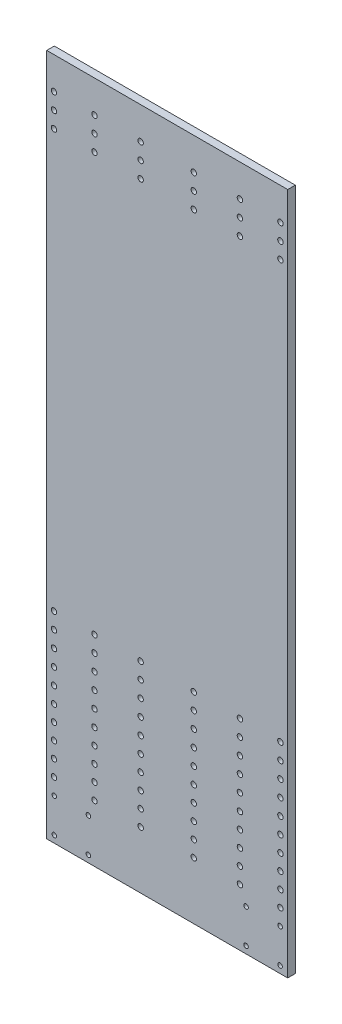
from build123d import *

# Parameters (mm, degrees)
ESQUISSE1_W              = 190.5
ESQUISSE1_H              = 539.75
BOSS_EXTRU_1_DEPTH       = 6
D_GAGEMENT_M41_OUTLINE_R = 2.15
D_GAGEMENT_M41_DEPTH     = 6
D_GAGEMENT_M31_D         = 3.6
D_GAGEMENT_M31_DEPTH     = 6
D_GAGEMENT_M31_TIP       = 1.081549114


# Read off the part's stored shape, not the designer's step: Dégagement M41
with BuildPart() as part:
    # Esquisse1 → Boss.-Extru.1 (new body)
    with BuildSketch(Plane.XY):
        Rectangle(ESQUISSE1_W, ESQUISSE1_H)
    extrude(amount=BOSS_EXTRU_1_DEPTH)

    # Dégagement M41 outline → Dégagement M41 (cut)
    with BuildSketch(Plane.XY):
        with Locations((89.49, -224.625)):
            Circle(D_GAGEMENT_M41_OUTLINE_R)
        with Locations((57.49, -224.625)):
            Circle(D_GAGEMENT_M41_OUTLINE_R)
        with Locations((21, -224.625)):
            Circle(D_GAGEMENT_M41_OUTLINE_R)
        with Locations((-21, -224.625)):
            Circle(D_GAGEMENT_M41_OUTLINE_R)
        with Locations((-57.49, -224.625)):
            Circle(D_GAGEMENT_M41_OUTLINE_R)
        with Locations((-89.49, -224.625)):
            Circle(D_GAGEMENT_M41_OUTLINE_R)
        with Locations((89.49, -212.125)):
            Circle(D_GAGEMENT_M41_OUTLINE_R)
        with Locations((57.49, -212.125)):
            Circle(D_GAGEMENT_M41_OUTLINE_R)
        with Locations((21, -212.125)):
            Circle(D_GAGEMENT_M41_OUTLINE_R)
        with Locations((-21, -212.125)):
            Circle(D_GAGEMENT_M41_OUTLINE_R)
        with Locations((-57.49, -212.125)):
            Circle(D_GAGEMENT_M41_OUTLINE_R)
        with Locations((-89.49, -212.125)):
            Circle(D_GAGEMENT_M41_OUTLINE_R)
        with Locations((89.49, -199.625)):
            Circle(D_GAGEMENT_M41_OUTLINE_R)
        with Locations((57.49, -199.625)):
            Circle(D_GAGEMENT_M41_OUTLINE_R)
        with Locations((21, -199.625)):
            Circle(D_GAGEMENT_M41_OUTLINE_R)
        with Locations((-21, -199.625)):
            Circle(D_GAGEMENT_M41_OUTLINE_R)
        with Locations((-57.49, -199.625)):
            Circle(D_GAGEMENT_M41_OUTLINE_R)
        with Locations((-89.49, -199.625)):
            Circle(D_GAGEMENT_M41_OUTLINE_R)
        with Locations((89.49, -187.125)):
            Circle(D_GAGEMENT_M41_OUTLINE_R)
        with Locations((57.49, -187.125)):
            Circle(D_GAGEMENT_M41_OUTLINE_R)
        with Locations((21, -187.125)):
            Circle(D_GAGEMENT_M41_OUTLINE_R)
        with Locations((-21, -187.125)):
            Circle(D_GAGEMENT_M41_OUTLINE_R)
        with Locations((-57.49, -187.125)):
            Circle(D_GAGEMENT_M41_OUTLINE_R)
        with Locations((-89.49, -187.125)):
            Circle(D_GAGEMENT_M41_OUTLINE_R)
        with Locations((89.49, -174.625)):
            Circle(D_GAGEMENT_M41_OUTLINE_R)
        with Locations((57.49, -174.625)):
            Circle(D_GAGEMENT_M41_OUTLINE_R)
        with Locations((21, -174.625)):
            Circle(D_GAGEMENT_M41_OUTLINE_R)
        with Locations((-21, -174.625)):
            Circle(D_GAGEMENT_M41_OUTLINE_R)
        with Locations((-57.49, -174.625)):
            Circle(D_GAGEMENT_M41_OUTLINE_R)
        with Locations((-89.49, -174.625)):
            Circle(D_GAGEMENT_M41_OUTLINE_R)
        with Locations((89.49, -161.925)):
            Circle(D_GAGEMENT_M41_OUTLINE_R)
        with Locations((57.49, -161.925)):
            Circle(D_GAGEMENT_M41_OUTLINE_R)
        with Locations((21, -161.925)):
            Circle(D_GAGEMENT_M41_OUTLINE_R)
        with Locations((-21, -161.925)):
            Circle(D_GAGEMENT_M41_OUTLINE_R)
        with Locations((-57.49, -161.925)):
            Circle(D_GAGEMENT_M41_OUTLINE_R)
        with Locations((-89.49, -161.925)):
            Circle(D_GAGEMENT_M41_OUTLINE_R)
        with Locations((89.49, -149.225)):
            Circle(D_GAGEMENT_M41_OUTLINE_R)
        with Locations((57.49, -149.225)):
            Circle(D_GAGEMENT_M41_OUTLINE_R)
        with Locations((21, -149.225)):
            Circle(D_GAGEMENT_M41_OUTLINE_R)
        with Locations((-21, -149.225)):
            Circle(D_GAGEMENT_M41_OUTLINE_R)
        with Locations((-57.49, -149.225)):
            Circle(D_GAGEMENT_M41_OUTLINE_R)
        with Locations((-89.49, -149.225)):
            Circle(D_GAGEMENT_M41_OUTLINE_R)
        with Locations((89.49, -136.525)):
            Circle(D_GAGEMENT_M41_OUTLINE_R)
        with Locations((57.49, -136.525)):
            Circle(D_GAGEMENT_M41_OUTLINE_R)
        with Locations((21, -136.525)):
            Circle(D_GAGEMENT_M41_OUTLINE_R)
        with Locations((-21, -136.525)):
            Circle(D_GAGEMENT_M41_OUTLINE_R)
        with Locations((-57.49, -136.525)):
            Circle(D_GAGEMENT_M41_OUTLINE_R)
        with Locations((-89.49, -136.525)):
            Circle(D_GAGEMENT_M41_OUTLINE_R)
        with Locations((89.49, -123.825)):
            Circle(D_GAGEMENT_M41_OUTLINE_R)
        with Locations((57.49, -123.825)):
            Circle(D_GAGEMENT_M41_OUTLINE_R)
        with Locations((21, -123.825)):
            Circle(D_GAGEMENT_M41_OUTLINE_R)
        with Locations((-21, -123.825)):
            Circle(D_GAGEMENT_M41_OUTLINE_R)
        with Locations((-57.49, -123.825)):
            Circle(D_GAGEMENT_M41_OUTLINE_R)
        with Locations((-89.49, -123.825)):
            Circle(D_GAGEMENT_M41_OUTLINE_R)
        with Locations((89.49, -111.125)):
            Circle(D_GAGEMENT_M41_OUTLINE_R)
        with Locations((57.49, -111.125)):
            Circle(D_GAGEMENT_M41_OUTLINE_R)
        with Locations((21, -111.125)):
            Circle(D_GAGEMENT_M41_OUTLINE_R)
        with Locations((-21, -111.125)):
            Circle(D_GAGEMENT_M41_OUTLINE_R)
        with Locations((-57.49, -111.125)):
            Circle(D_GAGEMENT_M41_OUTLINE_R)
        with Locations((-89.49, -111.125)):
            Circle(D_GAGEMENT_M41_OUTLINE_R)
        with Locations((89.49, 219.075)):
            Circle(D_GAGEMENT_M41_OUTLINE_R)
        with Locations((57.49, 219.075)):
            Circle(D_GAGEMENT_M41_OUTLINE_R)
        with Locations((21, 219.075)):
            Circle(D_GAGEMENT_M41_OUTLINE_R)
        with Locations((-21, 219.075)):
            Circle(D_GAGEMENT_M41_OUTLINE_R)
        with Locations((-57.49, 219.075)):
            Circle(D_GAGEMENT_M41_OUTLINE_R)
        with Locations((-89.49, 219.075)):
            Circle(D_GAGEMENT_M41_OUTLINE_R)
        with Locations((89.49, 231.775)):
            Circle(D_GAGEMENT_M41_OUTLINE_R)
        with Locations((57.49, 231.775)):
            Circle(D_GAGEMENT_M41_OUTLINE_R)
        with Locations((21, 231.775)):
            Circle(D_GAGEMENT_M41_OUTLINE_R)
        with Locations((-21, 231.775)):
            Circle(D_GAGEMENT_M41_OUTLINE_R)
        with Locations((-57.49, 231.775)):
            Circle(D_GAGEMENT_M41_OUTLINE_R)
        with Locations((-89.49, 231.775)):
            Circle(D_GAGEMENT_M41_OUTLINE_R)
        with Locations((89.49, 244.475)):
            Circle(D_GAGEMENT_M41_OUTLINE_R)
        with Locations((57.49, 244.475)):
            Circle(D_GAGEMENT_M41_OUTLINE_R)
        with Locations((21, 244.475)):
            Circle(D_GAGEMENT_M41_OUTLINE_R)
        with Locations((-21, 244.475)):
            Circle(D_GAGEMENT_M41_OUTLINE_R)
        with Locations((-57.49, 244.475)):
            Circle(D_GAGEMENT_M41_OUTLINE_R)
        with Locations((-89.49, 244.475)):
            Circle(D_GAGEMENT_M41_OUTLINE_R)
    extrude(amount=D_GAGEMENT_M41_DEPTH, mode=Mode.SUBTRACT)

    # Dégagement M31
    with Locations(Plane(origin=(-89.25, -237.355, 6), x_dir=(1, 0, 0), z_dir=(0, 0, 1))):
        with Locations((0, 0), (26.94, 0), (0, -26.94), (26.94, -26.94), (151.56, 0), (178.5, 0), (151.56, -26.94), (178.5, -26.94)):
            Hole(D_GAGEMENT_M31_D / 2, depth=D_GAGEMENT_M31_DEPTH)
            with Locations((0, 0, -(D_GAGEMENT_M31_DEPTH + D_GAGEMENT_M31_TIP / 2))):  # 118° drill point
                Cone(0, D_GAGEMENT_M31_D / 2, D_GAGEMENT_M31_TIP, mode=Mode.SUBTRACT)


solid = part.part
